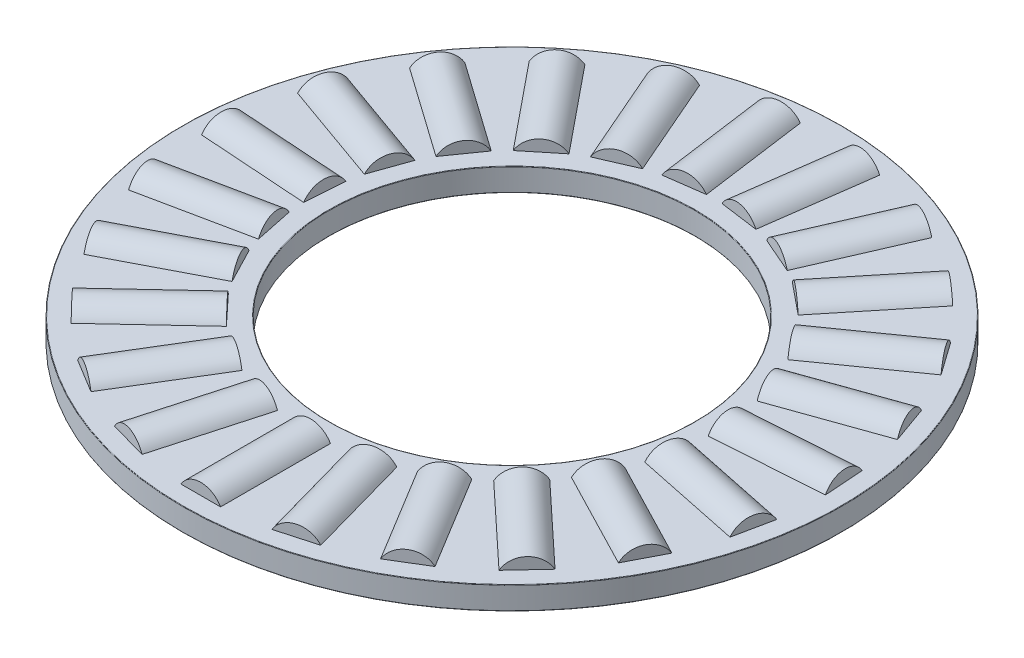
from build123d import *

# Parameters (mm, degrees)
SKETCH1_W         = 6.35
SKETCH1_H         = 0.9921875
SKETCH3_W         = 4.7625
SKETCH3_H         = 0.9921875
SKETCH2_W         = 4.7625
SKETCH2_H         = 0.9921875
CIRPATTERN1_COUNT = 23
CIRPATTERN1_ANGLE = 344.347826087
CIRPATTERN2_COUNT = 23
FILLET2_R         = 0.01984375


with BuildPart() as part:
    # Sketch1 → Revolve1 (revolve)
    with BuildSketch(Plane(origin=(0, 0, 0), x_dir=(0, 0, -1), z_dir=(1, 0, 0))):
        with Locations((-11.1125, 0)):
            Rectangle(SKETCH1_W, SKETCH1_H)
    revolve(axis=Axis((0, -0.9921875, 0), (0, 1, 0)))

    # Sketch3 → Cut-Revolve1 (revolve, cut)
    with BuildSketch(Plane(origin=(0, 0, 0), x_dir=(0, 0, -1), z_dir=(1, 0, 0))):
        with Locations((-11.1125, 0.49609375)):
            Rectangle(SKETCH3_W, SKETCH3_H)
    cut_revolve1 = revolve(axis=Axis((0, 0, 13.49375), (0, 0, -1)), mode=Mode.SUBTRACT)

    # CirPattern2: Cut-Revolve1 ×23 about axis
    cirpattern2_axis = Axis((0, 0.9921875, 0), (0, -1, 0))
    for i in range(1, CIRPATTERN2_COUNT):
        add(cut_revolve1.rotate(cirpattern2_axis, i * 360 / CIRPATTERN2_COUNT), mode=Mode.SUBTRACT)

    # Fillet2
    fillet2_edges = [part.edges().sort_by_distance(p)[0] for p in [
        (0, -0.49609375, -7.9375),
        (0, 0.49609375, -7.9375),
        (0, -0.49609375, -14.2875),
        (0, 0.49609375, -14.2875),
    ]]
    fillet(fillet2_edges, radius=FILLET2_R)


with BuildPart() as body_2:
    # Sketch2 → Revolve2 (revolve)
    with BuildSketch(Plane(origin=(0, 0, 0), x_dir=(0, 0, -1), z_dir=(1, 0, 0))):
        with Locations((-11.1125, 0.49609375)):
            Rectangle(SKETCH2_W, SKETCH2_H)
    revolve(axis=Axis((0, 0, 13.49375), (0, 0, -1)))


with BuildPart() as cirpattern1_1:
    # CirPattern1: pattern copy
    add(body_2.part.rotate(Axis((0, 0.9921875, 0), (0, -1, 0)), 1 * CIRPATTERN1_ANGLE / (CIRPATTERN1_COUNT - 1)))


with BuildPart() as cirpattern1_2:
    # CirPattern1: pattern copy
    add(body_2.part.rotate(Axis((0, 0.9921875, 0), (0, -1, 0)), 2 * CIRPATTERN1_ANGLE / (CIRPATTERN1_COUNT - 1)))


with BuildPart() as cirpattern1_3:
    # CirPattern1: pattern copy
    add(body_2.part.rotate(Axis((0, 0.9921875, 0), (0, -1, 0)), 3 * CIRPATTERN1_ANGLE / (CIRPATTERN1_COUNT - 1)))


with BuildPart() as cirpattern1_4:
    # CirPattern1: pattern copy
    add(body_2.part.rotate(Axis((0, 0.9921875, 0), (0, -1, 0)), 4 * CIRPATTERN1_ANGLE / (CIRPATTERN1_COUNT - 1)))


with BuildPart() as cirpattern1_5:
    # CirPattern1: pattern copy
    add(body_2.part.rotate(Axis((0, 0.9921875, 0), (0, -1, 0)), 5 * CIRPATTERN1_ANGLE / (CIRPATTERN1_COUNT - 1)))


with BuildPart() as cirpattern1_6:
    # CirPattern1: pattern copy
    add(body_2.part.rotate(Axis((0, 0.9921875, 0), (0, -1, 0)), 6 * CIRPATTERN1_ANGLE / (CIRPATTERN1_COUNT - 1)))


with BuildPart() as cirpattern1_7:
    # CirPattern1: pattern copy
    add(body_2.part.rotate(Axis((0, 0.9921875, 0), (0, -1, 0)), 7 * CIRPATTERN1_ANGLE / (CIRPATTERN1_COUNT - 1)))


with BuildPart() as cirpattern1_8:
    # CirPattern1: pattern copy
    add(body_2.part.rotate(Axis((0, 0.9921875, 0), (0, -1, 0)), 8 * CIRPATTERN1_ANGLE / (CIRPATTERN1_COUNT - 1)))


with BuildPart() as cirpattern1_9:
    # CirPattern1: pattern copy
    add(body_2.part.rotate(Axis((0, 0.9921875, 0), (0, -1, 0)), 9 * CIRPATTERN1_ANGLE / (CIRPATTERN1_COUNT - 1)))


with BuildPart() as cirpattern1_10:
    # CirPattern1: pattern copy
    add(body_2.part.rotate(Axis((0, 0.9921875, 0), (0, -1, 0)), 10 * CIRPATTERN1_ANGLE / (CIRPATTERN1_COUNT - 1)))


with BuildPart() as cirpattern1_11:
    # CirPattern1: pattern copy
    add(body_2.part.rotate(Axis((0, 0.9921875, 0), (0, -1, 0)), 11 * CIRPATTERN1_ANGLE / (CIRPATTERN1_COUNT - 1)))


with BuildPart() as cirpattern1_12:
    # CirPattern1: pattern copy
    add(body_2.part.rotate(Axis((0, 0.9921875, 0), (0, -1, 0)), 12 * CIRPATTERN1_ANGLE / (CIRPATTERN1_COUNT - 1)))


with BuildPart() as cirpattern1_13:
    # CirPattern1: pattern copy
    add(body_2.part.rotate(Axis((0, 0.9921875, 0), (0, -1, 0)), 13 * CIRPATTERN1_ANGLE / (CIRPATTERN1_COUNT - 1)))


with BuildPart() as cirpattern1_14:
    # CirPattern1: pattern copy
    add(body_2.part.rotate(Axis((0, 0.9921875, 0), (0, -1, 0)), 14 * CIRPATTERN1_ANGLE / (CIRPATTERN1_COUNT - 1)))


with BuildPart() as cirpattern1_15:
    # CirPattern1: pattern copy
    add(body_2.part.rotate(Axis((0, 0.9921875, 0), (0, -1, 0)), 15 * CIRPATTERN1_ANGLE / (CIRPATTERN1_COUNT - 1)))


with BuildPart() as cirpattern1_16:
    # CirPattern1: pattern copy
    add(body_2.part.rotate(Axis((0, 0.9921875, 0), (0, -1, 0)), 16 * CIRPATTERN1_ANGLE / (CIRPATTERN1_COUNT - 1)))


with BuildPart() as cirpattern1_17:
    # CirPattern1: pattern copy
    add(body_2.part.rotate(Axis((0, 0.9921875, 0), (0, -1, 0)), 17 * CIRPATTERN1_ANGLE / (CIRPATTERN1_COUNT - 1)))


with BuildPart() as cirpattern1_18:
    # CirPattern1: pattern copy
    add(body_2.part.rotate(Axis((0, 0.9921875, 0), (0, -1, 0)), 18 * CIRPATTERN1_ANGLE / (CIRPATTERN1_COUNT - 1)))


with BuildPart() as cirpattern1_19:
    # CirPattern1: pattern copy
    add(body_2.part.rotate(Axis((0, 0.9921875, 0), (0, -1, 0)), 19 * CIRPATTERN1_ANGLE / (CIRPATTERN1_COUNT - 1)))


with BuildPart() as cirpattern1_20:
    # CirPattern1: pattern copy
    add(body_2.part.rotate(Axis((0, 0.9921875, 0), (0, -1, 0)), 20 * CIRPATTERN1_ANGLE / (CIRPATTERN1_COUNT - 1)))


with BuildPart() as cirpattern1_21:
    # CirPattern1: pattern copy
    add(body_2.part.rotate(Axis((0, 0.9921875, 0), (0, -1, 0)), 21 * CIRPATTERN1_ANGLE / (CIRPATTERN1_COUNT - 1)))


with BuildPart() as cirpattern1_22:
    # CirPattern1: pattern copy
    add(body_2.part.rotate(Axis((0, 0.9921875, 0), (0, -1, 0)), 22 * CIRPATTERN1_ANGLE / (CIRPATTERN1_COUNT - 1)))


solid = Compound([part.part, body_2.part, cirpattern1_1.part, cirpattern1_2.part, cirpattern1_3.part, cirpattern1_4.part, cirpattern1_5.part, cirpattern1_6.part, cirpattern1_7.part, cirpattern1_8.part, cirpattern1_9.part, cirpattern1_10.part, cirpattern1_11.part, cirpattern1_12.part, cirpattern1_13.part, cirpattern1_14.part, cirpattern1_15.part, cirpattern1_16.part, cirpattern1_17.part, cirpattern1_18.part, cirpattern1_19.part, cirpattern1_20.part, cirpattern1_21.part, cirpattern1_22.part])
